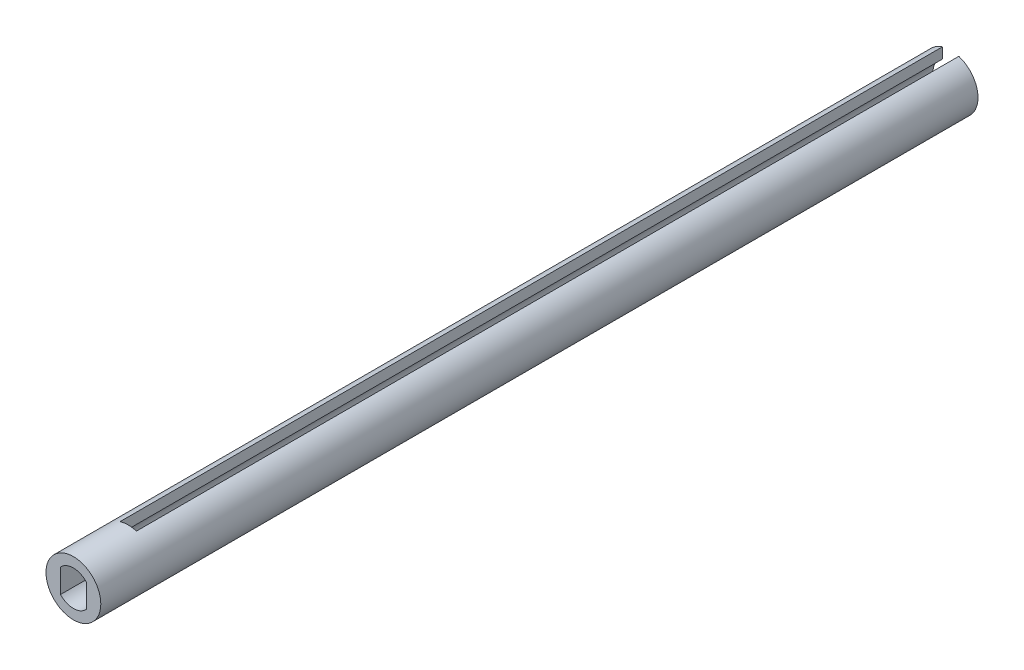
from build123d import *

# Parameters (mm, degrees)
SKETCH1_R           = 5
SKETCH1_R_2         = 3.2
BOSS_EXTRUDE1_DEPTH = 160
CUT_EXTRUDE1_DEPTH  = 150
FILLET1_R           = 5


with BuildPart() as part:
    # Sketch1 → Boss-Extrude1 (new body)
    # profile 1 of 3: a face of its own
    with BuildSketch(Plane.XY):
        Circle(SKETCH1_R)
        Circle(SKETCH1_R_2, mode=Mode.SUBTRACT)
    # profile 2 of 3: a face of its own
    with BuildSketch(Plane.XY):
        with BuildLine():
            ThreePointArc((3.2, 0), (2.979932885, 1.166190379), (2.35, 2.171980663))
            Line((2.35, 2.171980663), (2.35, -2.171980663))
            ThreePointArc((2.35, -2.171980663), (2.979932885, -1.166190379), (3.2, 0))
        make_face()
    # profile 3 of 3: a face of its own
    with BuildSketch(Plane.XY):
        with BuildLine():
            Line((-2.35, -2.171980663), (-2.35, 2.171980663))
            ThreePointArc((-2.35, 2.171980663), (-3.2, 0), (-2.35, -2.171980663))
        make_face()
    extrude(amount=BOSS_EXTRUDE1_DEPTH)

    # Sketch2 → Cut-Extrude1 (cut)
    with BuildSketch(Plane.XY):
        with BuildLine():
            Line((1.5, 0), (1.5, -2.826658805))
            ThreePointArc((1.5, -2.826658805), (2.74226184, -1.64924225), (3.2, 0))
            ThreePointArc((3.2, 0), (2.74226184, 1.64924225), (1.5, 2.826658805))
            Line((1.5, 2.826658805), (1.5, 0))
        make_face()
        with BuildLine():
            ThreePointArc((-1.5, 2.826658805), (0, 3.2), (1.5, 2.826658805))
            Line((1.5, 2.826658805), (1.5, 5))
            Line((1.5, 5), (-1.5, 5))
            Line((-1.5, 5), (-1.5, 2.826658805))
        make_face()
        with BuildLine():
            ThreePointArc((-1.5, 2.826658805), (-3.2, 0), (-1.5, -2.826658805))
            Line((-1.5, -2.826658805), (-1.5, 0))
            Line((-1.5, 0), (-1.5, 2.826658805))
        make_face()
    extrude(amount=CUT_EXTRUDE1_DEPTH, mode=Mode.SUBTRACT)

    # Fillet1
    # the kernel refuses this fillet: 5 mm, written as the material it takes off along each edge
    with BuildSketch(Plane(origin=(2.35, 14.671980663, 150), x_dir=(0, 0, 1), z_dir=(0, -1, 0))) as fillet1_piece_1_section:
        with BuildLine():
            CenterArc((FILLET1_R, -FILLET1_R), FILLET1_R, 90, 90)
            Line((0, -FILLET1_R), (0, 0))
            Line((0, 0), (FILLET1_R, 0))
        make_face()
    fillet1_piece_1 = extrude(amount=29.343961326, mode=Mode.PRIVATE)
    fillet1_piece_1 = fillet1_piece_1 & Plane(origin=(0, 0, 151.715946683), x_dir=(1, 0, 0), z_dir=(0, 0, -1)) * Cylinder(3.2, 79, mode=Mode.PRIVATE)
    add(fillet1_piece_1, mode=Mode.SUBTRACT)
    with BuildSketch(Plane(origin=(-2.35, -14.671980663, 150), x_dir=(-1, 0, 0), z_dir=(0, 1, 0))) as fillet1_piece_2_section:
        with BuildLine():
            CenterArc((FILLET1_R, FILLET1_R), FILLET1_R, 180, 90)
            Line((0, FILLET1_R), (0, 0))
            Line((0, 0), (FILLET1_R, 0))
        make_face()
    fillet1_piece_2 = extrude(amount=29.343961326, mode=Mode.PRIVATE)
    fillet1_piece_2 = fillet1_piece_2 & Plane(origin=(0, 0, 151.715946769), x_dir=(1, 0, 0), z_dir=(0, 0, -1)) * Cylinder(3.2, 79, mode=Mode.PRIVATE)
    add(fillet1_piece_2, mode=Mode.SUBTRACT)


solid = part.part
